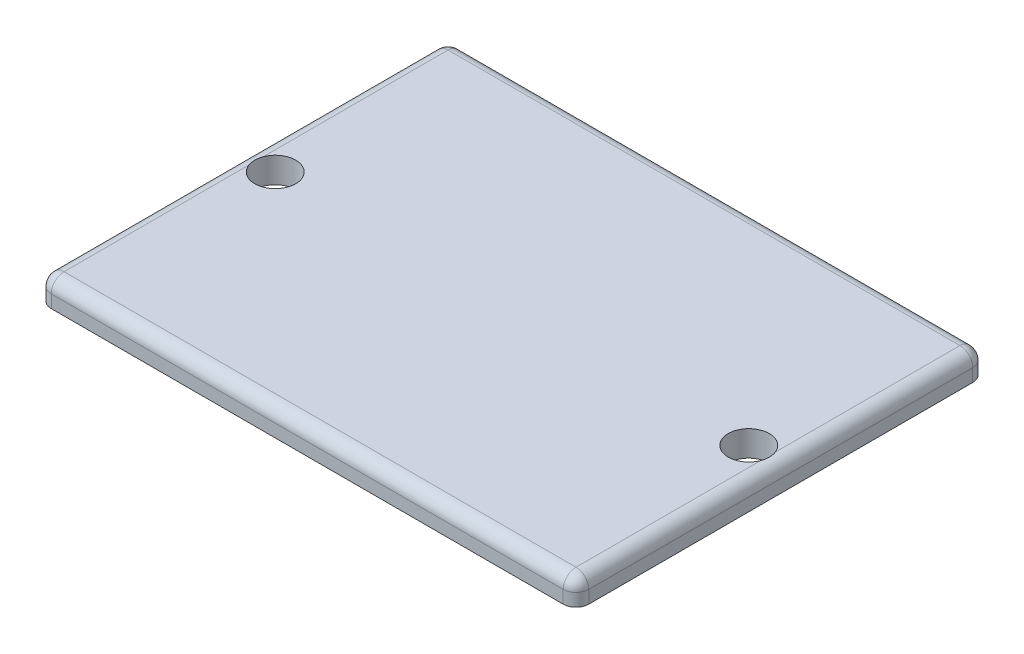
from build123d import *

# Parameters (mm, degrees)
SKETCH1_W           = 42
SKETCH1_H           = 32
SKETCH1_R           = 1.6
BOSS_EXTRUDE1_DEPTH = 2
FILLET1_R           = 1


with BuildPart() as part:
    # Sketch1 → Boss-Extrude1 (new body)
    with BuildSketch(Plane(origin=(0, 0, 0), x_dir=(1, 0, 0), z_dir=(0, 1, 0))):
        Rectangle(SKETCH1_W, SKETCH1_H)
        with Locations(Location((-18.5, 0, 0), (0, 0, 270))):
            Circle(SKETCH1_R, mode=Mode.SUBTRACT)
        with Locations(Location((18.5, 0, 0), (0, 0, 90))):
            Circle(SKETCH1_R, mode=Mode.SUBTRACT)
    extrude(amount=BOSS_EXTRUDE1_DEPTH)

    # Fillet1
    # the kernel refuses this fillet: 1 mm, written as the material it takes off along each edge
    with BuildSketch(Plane(origin=(-20, 1, -15), x_dir=(-1, 0, 0), z_dir=(0, 0, -1))) as fillet1_piece_1_section:
        Polygon((0, 0), (FILLET1_R, 0), (FILLET1_R, FILLET1_R), (0, FILLET1_R), align=None)
    fillet1_piece_1 = extrude(amount=FILLET1_R, mode=Mode.PRIVATE)
    fillet1_piece_1 = fillet1_piece_1 - Plane(origin=(-20, 1, -15), x_dir=(0.7071067811865475, -0.7071067811865475, 0), z_dir=(0, 0, -1)) * Sphere(FILLET1_R, mode=Mode.PRIVATE)
    add(fillet1_piece_1, mode=Mode.SUBTRACT)
    with BuildSketch(Plane(origin=(-20, 1, 15), x_dir=(-1, 0, 0), z_dir=(0, 0, 1))) as fillet1_piece_2_section:
        Polygon((0, 0), (FILLET1_R, 0), (FILLET1_R, -FILLET1_R), (0, -FILLET1_R), align=None)
    fillet1_piece_2 = extrude(amount=FILLET1_R, mode=Mode.PRIVATE)
    fillet1_piece_2 = fillet1_piece_2 - Plane(origin=(-20, 1, 15), x_dir=(0.7071067811865475, -0.7071067811865475, 0), z_dir=(0, 0, 1)) * Sphere(FILLET1_R, mode=Mode.PRIVATE)
    add(fillet1_piece_2, mode=Mode.SUBTRACT)
    with BuildSketch(Plane(origin=(20, 1, 15), x_dir=(1, 0, 0), z_dir=(0, 0, 1))) as fillet1_piece_3_section:
        Polygon((0, 0), (FILLET1_R, 0), (FILLET1_R, FILLET1_R), (0, FILLET1_R), align=None)
    fillet1_piece_3 = extrude(amount=FILLET1_R, mode=Mode.PRIVATE)
    fillet1_piece_3 = fillet1_piece_3 - Plane(origin=(20, 1, 15), x_dir=(-0.7071067811865475, -0.7071067811865475, 0), z_dir=(0, 0, 1)) * Sphere(FILLET1_R, mode=Mode.PRIVATE)
    add(fillet1_piece_3, mode=Mode.SUBTRACT)
    with BuildSketch(Plane(origin=(20, 1, -15), x_dir=(0, 0, -1), z_dir=(1, 0, 0))) as fillet1_piece_4_section:
        Polygon((0, 0), (FILLET1_R, 0), (FILLET1_R, FILLET1_R), (0, FILLET1_R), align=None)
    fillet1_piece_4 = extrude(amount=FILLET1_R, mode=Mode.PRIVATE)
    fillet1_piece_4 = fillet1_piece_4 - Plane(origin=(20, 1, -15), x_dir=(0, -0.7071067811865475, 0.7071067811865475), z_dir=(1, 0, 0)) * Sphere(FILLET1_R, mode=Mode.PRIVATE)
    add(fillet1_piece_4, mode=Mode.SUBTRACT)
    with BuildSketch(Plane(origin=(-21, 2, -15), x_dir=(0, -1, 0), z_dir=(0, 0, 1)), Plane(origin=(21, 2, 15), x_dir=(0, -1, 0), z_dir=(0, 0, -1))) as fillet1_piece_5:
        with BuildLine():
            CenterArc((FILLET1_R, FILLET1_R), FILLET1_R, 180, 90)
            Line((0, FILLET1_R), (0, 0))
            Line((0, 0), (FILLET1_R, 0))
        make_face()
    extrude(amount=30, mode=Mode.SUBTRACT)
    with BuildSketch(Plane(origin=(-20, 2, 16), x_dir=(0, -1, 0), z_dir=(1, 0, 0)), Plane(origin=(20, 2, -16), x_dir=(0, -1, 0), z_dir=(-1, 0, 0))) as fillet1_piece_6:
        with BuildLine():
            CenterArc((FILLET1_R, FILLET1_R), FILLET1_R, 180, 90)
            Line((0, FILLET1_R), (0, 0))
            Line((0, 0), (FILLET1_R, 0))
        make_face()
    extrude(amount=40, mode=Mode.SUBTRACT)
    with BuildSketch(Plane(origin=(21, -2.5, 16), x_dir=(-1, 0, 0), z_dir=(0, 1, 0)), Plane(origin=(-21, -2.5, -16), x_dir=(1, 0, 0), z_dir=(0, 1, 0)), Plane(origin=(21, -2.5, -16), x_dir=(0, 0, 1), z_dir=(0, 1, 0))) as fillet1_piece_7:
        with BuildLine():
            CenterArc((FILLET1_R, -FILLET1_R), FILLET1_R, 90, 90)
            Line((0, -FILLET1_R), (0, 0))
            Line((0, 0), (FILLET1_R, 0))
        make_face()
    extrude(amount=3.5, mode=Mode.SUBTRACT)
    with BuildSketch(Plane(origin=(-21, -2.5, 16), x_dir=(1, 0, 0), z_dir=(0, 1, 0))) as fillet1_piece_8:
        with BuildLine():
            CenterArc((FILLET1_R, FILLET1_R), FILLET1_R, 180, 90)
            Line((0, FILLET1_R), (0, 0))
            Line((0, 0), (FILLET1_R, 0))
        make_face()
    extrude(amount=3.5, mode=Mode.SUBTRACT)


solid = part.part
